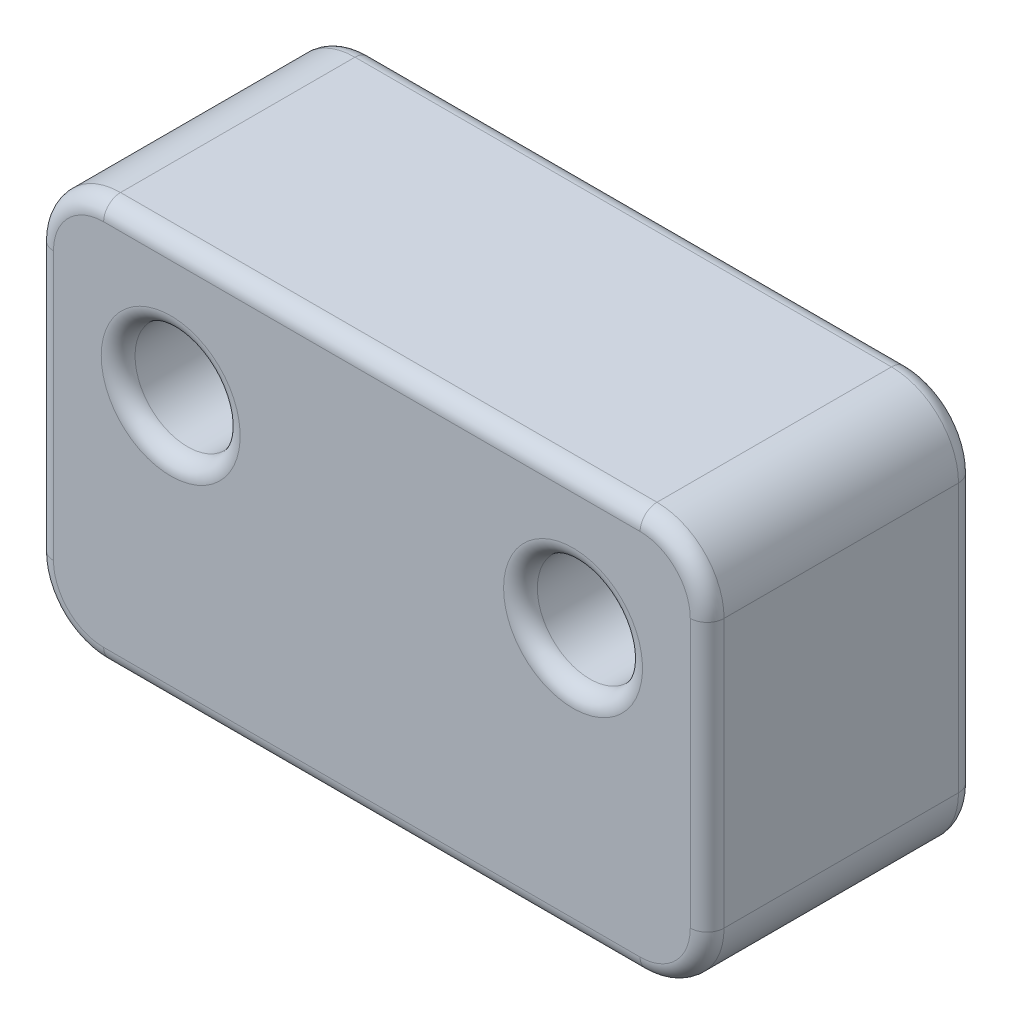
from build123d import *

# Parameters (mm, degrees)
SKETCH1_W           = 31.75
SKETCH1_H           = 19.05
SKETCH1_R           = 2.4892
BOSS_EXTRUDE1_DEPTH = 6.35
FILLET1_R           = 3.175
FILLET2_R           = 0.8


with BuildPart() as part:
    # Sketch1 → Boss-Extrude1 (new, symmetric)
    with BuildSketch(Plane.XY):
        with Locations((15.875, 9.525)):
            Rectangle(SKETCH1_W, SKETCH1_H)
        with Locations((6.35, 12.7)):
            Circle(SKETCH1_R, mode=Mode.SUBTRACT)
        with Locations((25.4, 12.7)):
            Circle(SKETCH1_R, mode=Mode.SUBTRACT)
    extrude(amount=BOSS_EXTRUDE1_DEPTH, both=True)

    # Fillet1
    fillet1_edges = [part.edges().sort_by_distance(p)[0] for p in [
        (31.75, 19.05, 0),
        (31.75, 0, 0),
        (0, 0, 0),
        (0, 19.05, 0),
    ]]
    fillet(fillet1_edges, radius=FILLET1_R)

    # Fillet2
    fillet2_edges = [part.edges().sort_by_distance(p)[0] for p in [
        (22.9108, 12.7, -6.35),
        (22.9108, 12.7, 6.35),
        (3.8608, 12.7, -6.35),
        (3.8608, 12.7, 6.35),
        (15.875, 0, -6.35),
        (31.75, 9.525, -6.35),
        (15.875, 19.05, -6.35),
        (0, 9.525, 6.35),
        (15.875, 0, 6.35),
        (31.75, 9.525, 6.35),
        (0.92993597, 18.12006403, -6.35),
        (0.92993597, 0.92993597, -6.35),
        (30.82006403, 0.92993597, -6.35),
        (30.82006403, 18.12006403, -6.35),
        (0.92993597, 18.12006403, 6.35),
        (0.92993597, 0.92993597, 6.35),
        (30.82006403, 0.92993597, 6.35),
        (30.82006403, 18.12006403, 6.35),
        (0, 9.525, -6.35),
        (15.875, 19.05, 6.35),
    ]]
    fillet(fillet2_edges, radius=FILLET2_R)


solid = part.part
